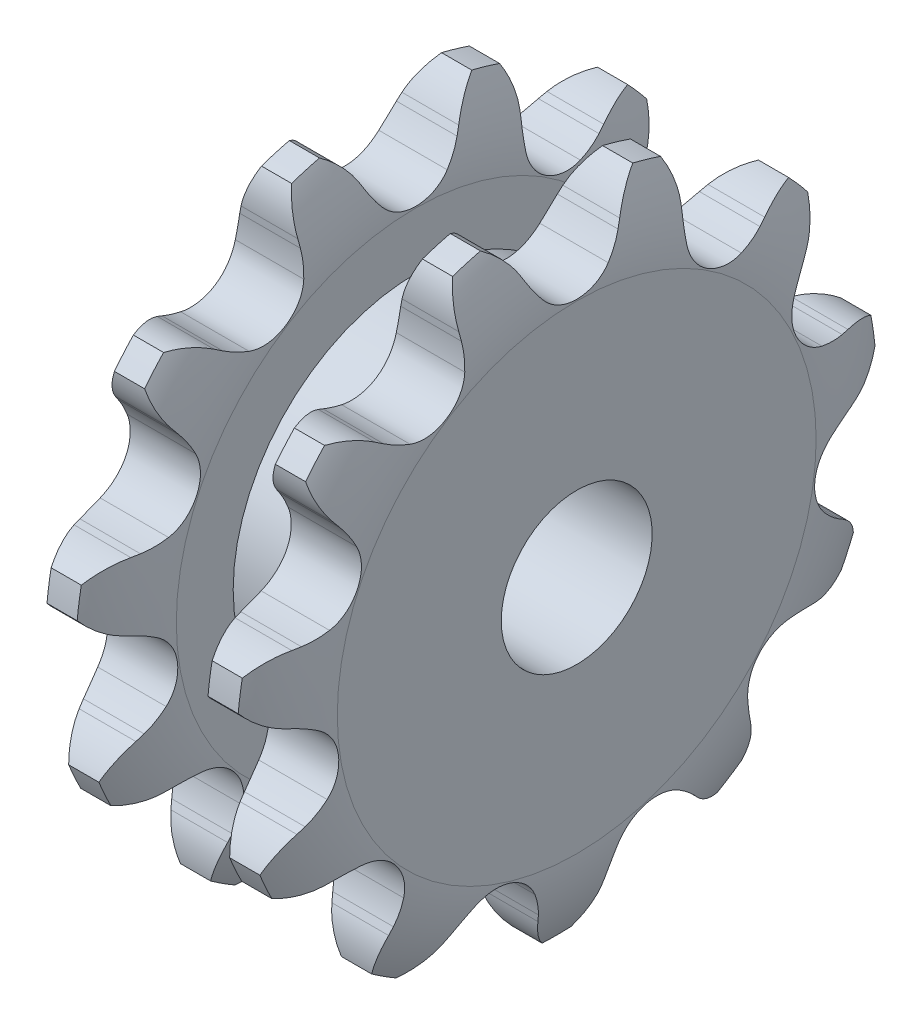
from build123d import *

# Parameters (mm, degrees)
TOOTHCUT_DEPTH  = 21.202424298
TEETHCUTS_COUNT = 11
TEETHCUTS_ANGLE = 327.272727273
BORSKE_R        = 3
BORE_DEPTH      = 95.0005


with BuildPart() as part:
    # BasProSke → Base-Revolve (revolve)
    with BuildSketch(Plane(origin=(0, 0, 0), x_dir=(1, 0, 0), z_dir=(0, 1, 0))):
        with BuildLine():
            Line((0, 0), (0, 9.518056997))
            ThreePointArc((0, 9.518056997), (0.203030999, 11.167299247), (0.8, 12.718056997))
            Line((0.8, 12.718056997), (8.4, 12.718056997))
            ThreePointArc((8.4, 12.718056997), (8.996969001, 11.167299247), (9.2, 9.518056997))
            Line((9.2, 9.518056997), (9.2, 0))
            Line((9.2, 0), (0, 0))
        make_face()
    revolve(axis=Axis((-10, 0, 0), (1, 0, 0)))

    # GrvSke → Groove (revolve, cut)
    with BuildSketch(Plane(origin=(0, 0, 0), x_dir=(1, 0, 0), z_dir=(0, 1, 0))):
        with BuildLine():
            Line((2.8, 9.518056997), (2.8, 7.257056997))
            Line((2.8, 7.257056997), (6.4, 7.257056997))
            Line((6.4, 7.257056997), (6.4, 9.518056997))
            ThreePointArc((6.4, 9.518056997), (6.603030999, 11.167299247), (7.2, 12.718056997))
            Line((7.2, 12.718056997), (2, 12.718056997))
            ThreePointArc((2, 12.718056997), (2.596969001, 11.167299247), (2.8, 9.518056997))
        make_face()
    revolve(axis=Axis((0, 0, 0), (1, 0, 0)), mode=Mode.SUBTRACT)

    # TooCutSke → ToothCut (cut, through all)
    with BuildSketch(Plane(origin=(0, 0, 0), x_dir=(0, 0, -1), z_dir=(1, 0, 0))):
        with BuildLine():
            Line((1.837060642, 10.97698183), (1.978719652, 11.248579964))
            ThreePointArc((1.978719652, 11.248579964), (2.999002223, 12.336626305), (4.435544119, 12.738084582))
            ThreePointArc((4.435544119, 12.738084582), (0, 13.488248606), (-4.435544119, 12.738084582))
            ThreePointArc((-4.435544119, 12.738084582), (-2.999002223, 12.336626305), (-1.978719652, 11.248579964))
            Line((-1.978719652, 11.248579964), (-1.837060642, 10.97698183))
            ThreePointArc((-1.837060642, 10.97698183), (-1.587107929, 10.557228104), (-1.291552986, 10.16823347))
            ThreePointArc((-1.291552986, 10.16823347), (0, 9.572198079), (1.291552986, 10.16823347))
            ThreePointArc((1.291552986, 10.16823347), (1.587107929, 10.557228104), (1.837060642, 10.97698183))
        make_face()
    toothcut = extrude(amount=TOOTHCUT_DEPTH, mode=Mode.SUBTRACT)

    # TeethCuts: ToothCut ×11 about axis
    teethcuts_axis = Axis((-10, 0, 0), (1, 0, 0))
    for i in range(1, TEETHCUTS_COUNT):
        add(toothcut.rotate(teethcuts_axis, i * TEETHCUTS_ANGLE / (TEETHCUTS_COUNT - 1)), mode=Mode.SUBTRACT)

    # BorSke → Bore (cut, symmetric)
    with BuildSketch(Plane(origin=(0, 0, 0), x_dir=(0, 0, -1), z_dir=(1, 0, 0))):
        Circle(BORSKE_R)
    extrude(amount=BORE_DEPTH, both=True, mode=Mode.SUBTRACT)


solid = part.part
